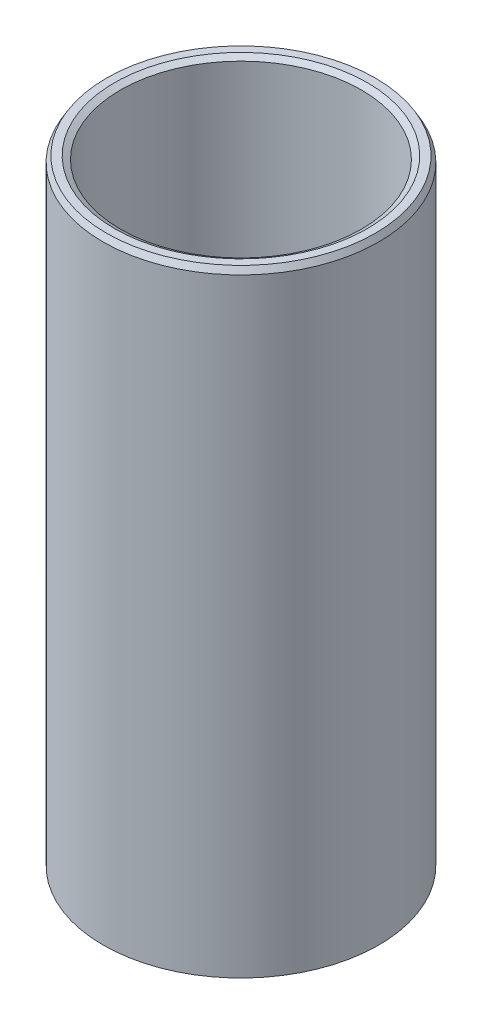
from build123d import *
from OCP.BRepFilletAPI import BRepFilletAPI_MakeChamfer

# Parameters (mm, degrees)
SKETCH1_R           = 30
BOSS_EXTRUDE1_DEPTH = 134.570657126
SKETCH2_R           = 26.243278425
CUT_EXTRUDE1_DEPTH  = 142.100183413
CHAMFER1_SIZE       = 1.279914789
CHAMFER1_SIZE2      = 0.738959148


with BuildPart() as part:
    # Sketch1 → Boss-Extrude1 (new body)
    with BuildSketch(Plane(origin=(0, 0, 0), x_dir=(1, 0, 0), z_dir=(0, 1, 0))):
        Circle(SKETCH1_R)
    extrude(amount=BOSS_EXTRUDE1_DEPTH)

    # Sketch2 → Cut-Extrude1 (cut, through all)
    with BuildSketch(Plane(origin=(0, 0, 0), x_dir=(1, 0, 0), z_dir=(0, 1, 0))):
        Circle(SKETCH2_R)
    extrude(amount=CUT_EXTRUDE1_DEPTH, mode=Mode.SUBTRACT)

    # Chamfer1: one chamfer whose edges measure the first distance from different faces: ONE call of the kernel's chamfer builder (chamfer() names one face for all edges)
    chamfer1_edges_1 = [part.edges().sort_by_distance(p)[0] for p in [
        (-26.243278425, 134.570657126, 0),
    ]]
    chamfer1_side_1 = [part.faces().sort_by_distance(p)[0] for p in [
        (-29.151471863, 134.570657126, 0),
    ]]
    chamfer1_edges_2 = [part.edges().sort_by_distance(p)[0] for p in [
        (-26.243278425, 0, 0),
    ]]
    chamfer1_side_2 = [part.faces().sort_by_distance(p)[0] for p in [
        (-26.243278425, 67.285328563, 0),
    ]]
    chamfer1_edges_3 = [part.edges().sort_by_distance(p)[0] for p in [
        (-30, 0, 0),
    ]]
    chamfer1_side_3 = [part.faces().sort_by_distance(p)[0] for p in [
        (-29.151471863, 0, 0),
    ]]
    chamfer1_edges_4 = [part.edges().sort_by_distance(p)[0] for p in [
        (-30, 134.570657126, 0),
    ]]
    chamfer1_side_4 = [part.faces().sort_by_distance(p)[0] for p in [
        (-30, 67.285328563, 0),
    ]]
    chamfer1 = BRepFilletAPI_MakeChamfer(part.part.solid().wrapped)
    for e in chamfer1_edges_1:
        chamfer1.Add(CHAMFER1_SIZE, CHAMFER1_SIZE2, e.wrapped, chamfer1_side_1[0].wrapped)  # the first distance lies on this face
    for e in chamfer1_edges_2:
        chamfer1.Add(CHAMFER1_SIZE, CHAMFER1_SIZE2, e.wrapped, chamfer1_side_2[0].wrapped)  # the first distance lies on this face
    for e in chamfer1_edges_3:
        chamfer1.Add(CHAMFER1_SIZE, CHAMFER1_SIZE2, e.wrapped, chamfer1_side_3[0].wrapped)  # the first distance lies on this face
    for e in chamfer1_edges_4:
        chamfer1.Add(CHAMFER1_SIZE, CHAMFER1_SIZE2, e.wrapped, chamfer1_side_4[0].wrapped)  # the first distance lies on this face
    add(Compound.cast(chamfer1.Shape()), mode=Mode.REPLACE)


solid = part.part
